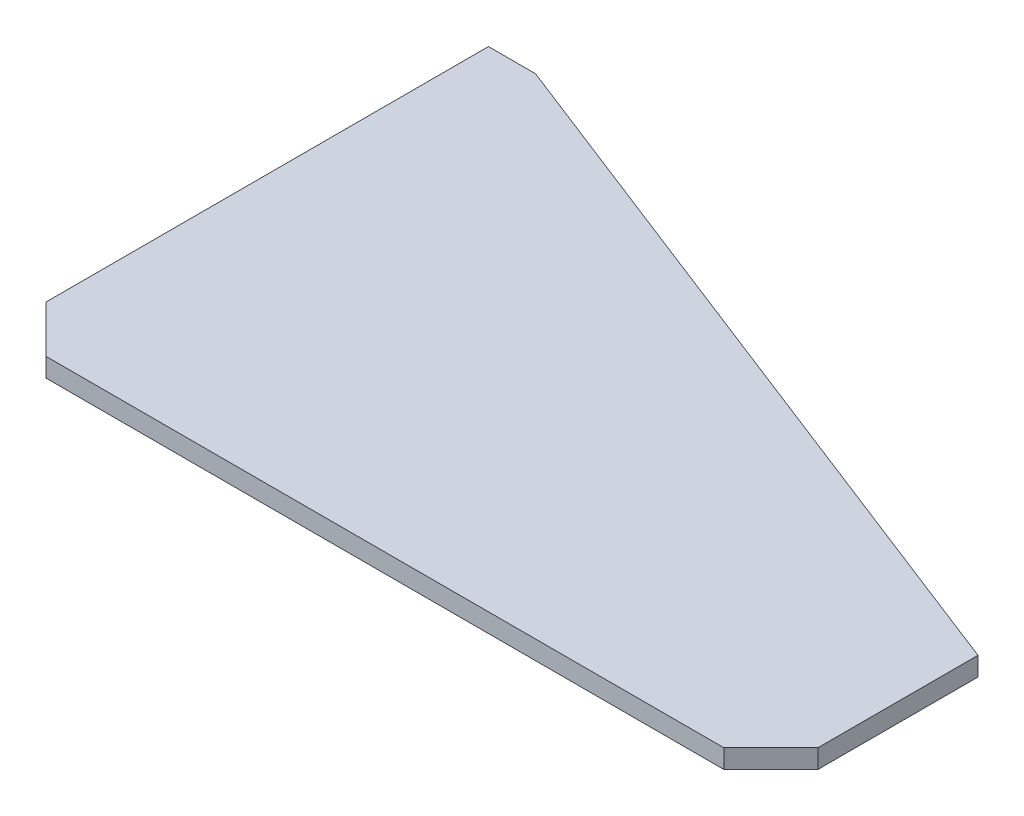
from build123d import *

# Parameters (mm, degrees)
EXTRUDE_1_DEPTH      = 1
EXTRUDE_1_DEPTH_BACK = 1
CHAMFER_2_SIZE       = 5


with BuildPart() as part:
    # Эскиз1 → Бобышка-Вытянуть1 (new, two sides: drawn at the far end of the back side and taken through both)
    with BuildSketch(Plane(origin=(0, 0, 0), x_dir=(1, 0, 0), z_dir=(0, 1, 0)).offset(-EXTRUDE_1_DEPTH_BACK)):
        Polygon((5, 52), (82, 22), (82, 0), (0, 0), (0, 52), align=None)
    extrude(amount=EXTRUDE_1_DEPTH + EXTRUDE_1_DEPTH_BACK)

    # Фаска2
    chamfer_2_edges = [part.edges().sort_by_distance(p)[0] for p in [
        (0, 0, 0),
        (82, 0, 0),
    ]]
    chamfer(chamfer_2_edges, length=CHAMFER_2_SIZE)


solid = part.part
